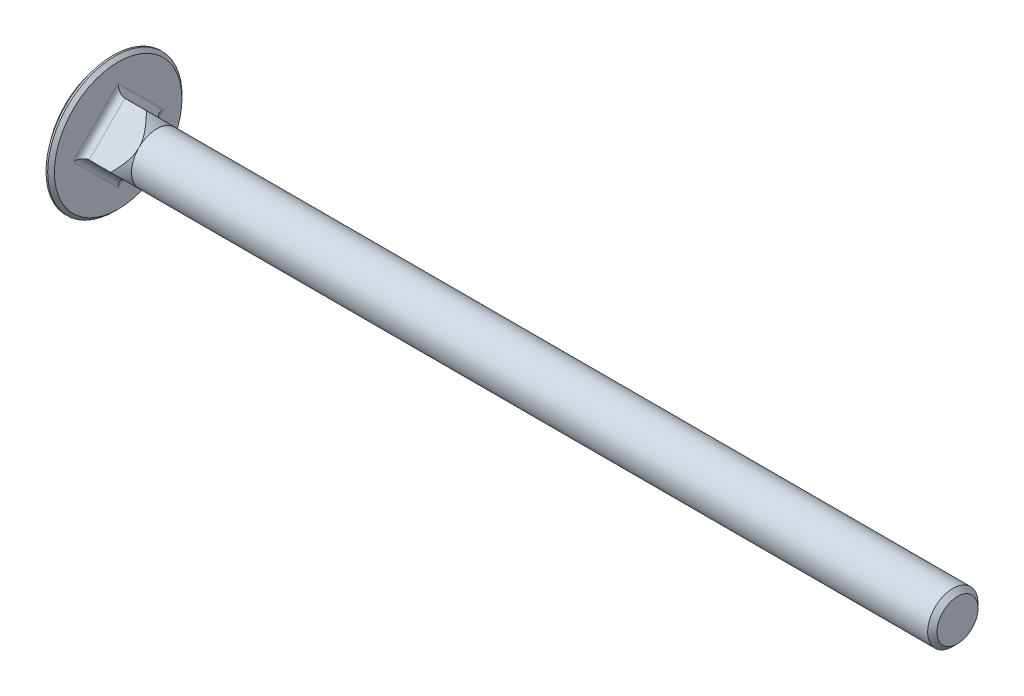
from build123d import *

# Parameters (mm, degrees)
BOSS_EXTRUDE1_DEPTH = 4.6
FILLET1_R           = 0.8


with BuildPart() as part:
    # BodySke → Base-Revolve (revolve)
    with BuildSketch(Plane.XY):
        with BuildLine():
            Line((3.0024, 8), (3.6, 8))
            Line((3.6, 8), (3.6, 3))
            Line((3.6, 3), (103.0455, 3))
            Line((103.0455, 3), (103.6, 2.4455))
            Line((103.6, 2.4455), (103.6, 0))
            Line((103.6, 0), (0, 0))
            ThreePointArc((0, 0), (0.775318389, 4.272423369), (3.0024, 8))
        make_face()
    revolve(axis=Axis((-31.75, 0, 0), (1, 0, 0)))

    # Sketch1 → Boss-Extrude1 (add)
    with BuildSketch(Plane(origin=(3.6, 0, 0), x_dir=(0, 0, -1), z_dir=(1, 0, 0))):
        Polygon((0, 4.242640687), (4.242640687, 0), (0, -4.242640687), (-4.242640687, 0), align=None)
    extrude(amount=BOSS_EXTRUDE1_DEPTH)

    # Sketch2 → Cut-Revolve1 (revolve, cut)
    with BuildSketch(Plane.XY):
        Polygon((8.2, 3), (13.2, 3), (13.2, 9), (2.2, 9), align=None)
    revolve(axis=Axis((0, 0, 0), (1, 0, 0)), mode=Mode.SUBTRACT)

    # Fillet1
    fillet1_edges = [part.edges().sort_by_distance(p)[0] for p in [
        (3.6, 2.121320344, 2.121320344),
        (3.6, -2.121320344, 2.121320344),
        (3.6, -2.121320344, -2.121320344),
        (3.6, 2.121320344, -2.121320344),
    ]]
    fillet(fillet1_edges, radius=FILLET1_R)


solid = part.part
